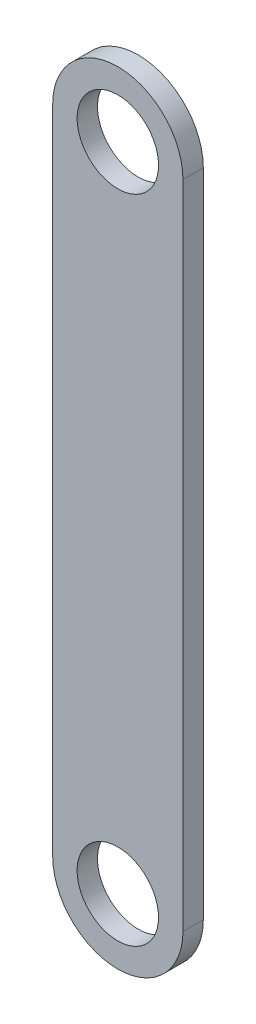
from build123d import *

# Parameters (mm, degrees)
SKETCH1_R           = 7.9375
BOSS_EXTRUDE1_DEPTH = 3.96875
SCALE1_SCALE        = 0.75


with BuildPart() as part:
    # Sketch1 → Boss-Extrude1 (new body)
    with BuildSketch(Plane.XY):
        with BuildLine():
            Line((-12.7, 0), (-12.7, 127))
            ThreePointArc((-12.7, 127), (0, 139.7), (12.7, 127))
            Line((12.7, 127), (12.7, 0))
            ThreePointArc((12.7, 0), (0, -12.7), (-12.7, 0))
        make_face()
        Circle(SKETCH1_R, mode=Mode.SUBTRACT)
        with Locations((0, 127)):
            Circle(SKETCH1_R, mode=Mode.SUBTRACT)
    extrude(amount=BOSS_EXTRUDE1_DEPTH)


with BuildPart() as part_1:
    # Scale1: scaled about (0, 63.5, 1.984375)
    add(part.part.scale(SCALE1_SCALE).moved(Location((0, 15.875, 0.49609375))))


solid = part_1.part
